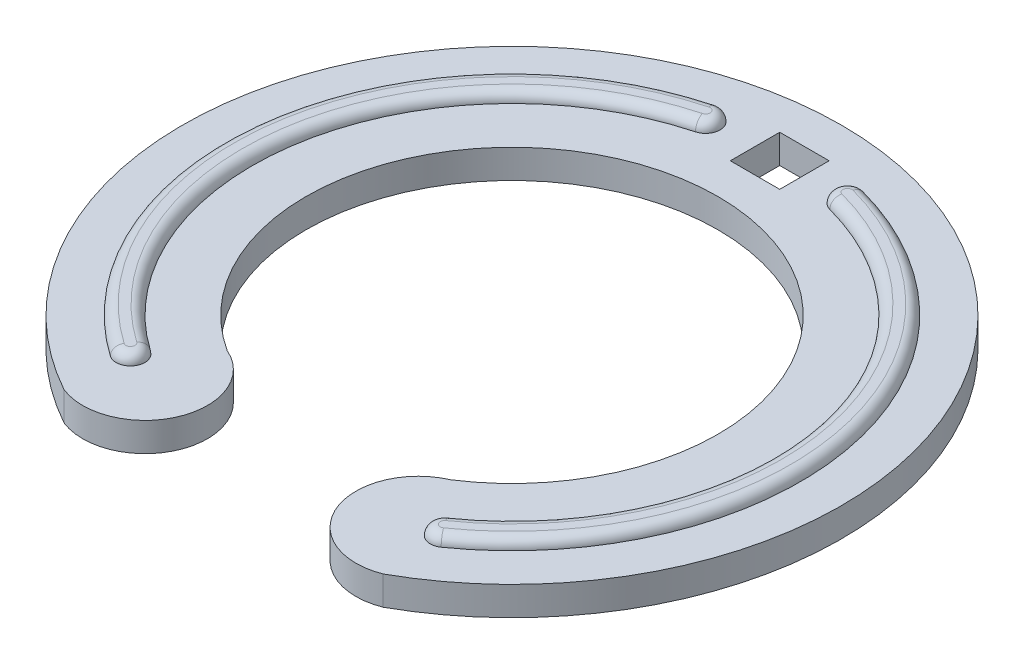
from build123d import *

# Parameters (mm, degrees)
ESQUISSE1_W           = 6
ESQUISSE1_H           = 6
BOSS_EXTRU_2_DEPTH    = 3.5
BOSS_EXTRU_3_DEPTH    = 1.2
CONG_2_R              = 1.2
CONG_2_OF_SYM_TRIE2_R = 1.2


with BuildPart() as part:
    # Esquisse1 → Boss.-Extru.2 (new body)
    with BuildSketch(Plane(origin=(0, 0, 0), x_dir=(1, 0, 0), z_dir=(0, 1, 0))):
        with BuildLine():
            ThreePointArc((19.364916731, -35), (0, 40), (-19.364916731, -35))
            ThreePointArc((-19.364916731, -35), (-9.581446139, -30.851796587), (-13.564659966, -21))
            ThreePointArc((-13.564659966, -21), (0, 25), (13.564659966, -21))
            ThreePointArc((13.564659966, -21), (9.581446139, -30.851796587), (19.364916731, -35))
        make_face()
        with Locations((0, 32.5)):
            Rectangle(ESQUISSE1_W, ESQUISSE1_H, mode=Mode.SUBTRACT)
    extrude(amount=BOSS_EXTRU_2_DEPTH)

    # Esquisse5 → Boss.-Extru.3 (add)
    with BuildSketch(Plane(origin=(0, 3.5, 0), x_dir=(1, 0, 0), z_dir=(0, 1, 0))):
        with BuildLine():
            ThreePointArc((-20.075175272, -28.67032155), (-34.468271355, 6.077686218), (-9.058666579, 33.80740392))
            ThreePointArc((-9.058666579, 33.80740392), (-6.915363054, 32.569967053), (-8.152799921, 30.426663528))
            ThreePointArc((-8.152799921, 30.426663528), (-31.02144422, 5.469917597), (-18.067657745, -25.803289395))
            ThreePointArc((-18.067657745, -25.803289395), (-17.637900431, -28.240564236), (-20.075175272, -28.67032155))
        make_face()
    boss_extru_3 = extrude(amount=BOSS_EXTRU_3_DEPTH)

    # Congé2
    cong_2_edges = [part.edges().sort_by_distance(p)[0] for p in [
        (-34.468271355, 4.7, -6.077686218),
        (-6.915363054, 4.7, -32.569967053),
        (-31.02144422, 4.7, -5.469917597),
        (-17.637900431, 4.7, 28.240564236),
    ]]
    fillet(cong_2_edges, radius=CONG_2_R - 0.0001)  # a hair under: the kernel refuses the full size

    # Symétrie2: Boss.-Extru.3 across plane
    add(boss_extru_3.mirror(Plane(origin=(0, 0, 0), x_dir=(0, 0, 1), z_dir=(1, 0, 0))))

    # Congé2 of Symétrie2
    cong_2_of_sym_trie2_edges = [part.edges().sort_by_distance(p)[0] for p in [
        (34.468271355, 4.7, -6.077686218),
        (6.915363054, 4.7, -32.569967053),
        (31.02144422, 4.7, -5.469917597),
        (17.637900431, 4.7, 28.240564236),
    ]]
    fillet(cong_2_of_sym_trie2_edges, radius=CONG_2_OF_SYM_TRIE2_R - 0.0001)  # a hair under: the kernel refuses the full size


solid = part.part
